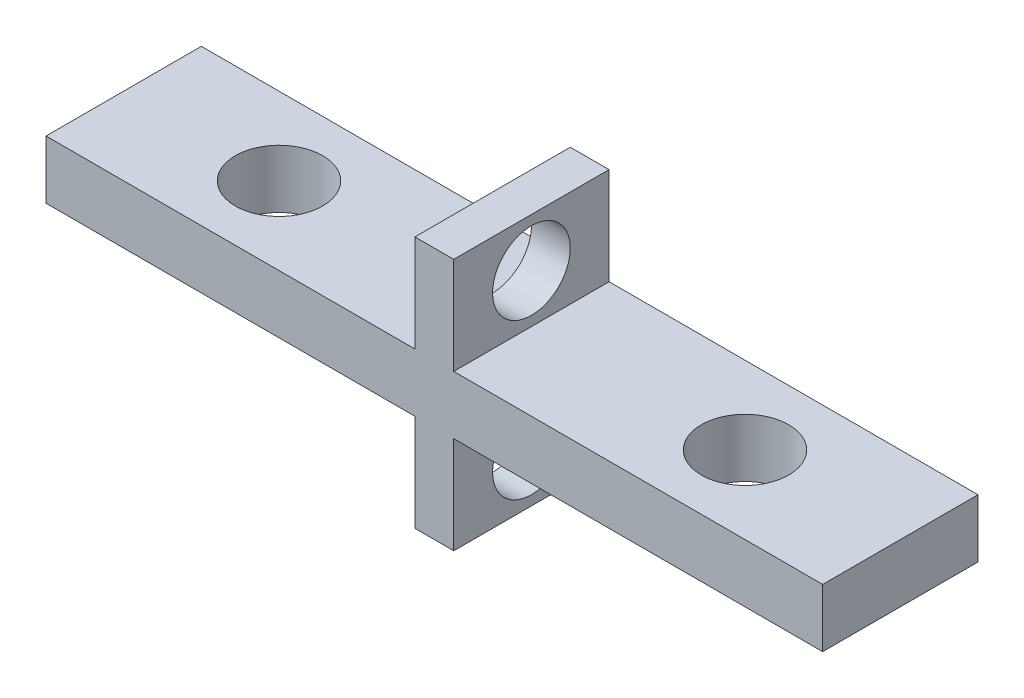
from build123d import *

# Parameters (mm, degrees)
SKETCH1_W                 = 40
SKETCH1_H                 = 8
BOSS_EXTRUDE1_DEPTH       = 3
F_8_CLEARANCE_HOLE1_D     = 4.4958
F_8_CLEARANCE_HOLE1_DEPTH = 17
F_8_CLEARANCE_HOLE1_TIP   = 1.350674586
BOSS_EXTRUDE2_DEPTH       = 5
BOSS_EXTRUDE2_DEPTH_BACK  = 8
SKETCH5_W                 = 2
SKETCH5_H                 = 8
SKETCH6_R                 = 2
CUT_EXTRUDE1_DEPTH        = 2


with BuildPart() as part:
    # Sketch1 → Boss-Extrude1 (new body)
    with BuildSketch(Plane(origin=(0, 0, 0), x_dir=(1, 0, 0), z_dir=(0, 1, 0))):
        with Locations((12.773632998, 0.313559322)):
            Rectangle(SKETCH1_W, SKETCH1_H)
    extrude(amount=BOSS_EXTRUDE1_DEPTH)

    # #8 Clearance Hole1
    with Locations(Plane(origin=(0.773632998, 3, -0.313559322), x_dir=(0, 0, 1), z_dir=(0, 1, 0))):
        with Locations((0, 0), (0, 24)):
            Hole(F_8_CLEARANCE_HOLE1_D / 2, depth=F_8_CLEARANCE_HOLE1_DEPTH)
            with Locations((0, 0, -(F_8_CLEARANCE_HOLE1_DEPTH + F_8_CLEARANCE_HOLE1_TIP / 2))):  # 118° drill point
                Cone(0, F_8_CLEARANCE_HOLE1_D / 2, F_8_CLEARANCE_HOLE1_TIP, mode=Mode.SUBTRACT)

    # Sketch5 → Boss-Extrude2 (add, two sides: drawn at the far end of the back side and taken through both)
    with BuildSketch(Plane(origin=(0, 3, 0), x_dir=(1, 0, 0), z_dir=(0, 1, 0)).offset(-BOSS_EXTRUDE2_DEPTH_BACK)):
        with Locations((12.773632998, 0.313559322)):
            Rectangle(SKETCH5_W, SKETCH5_H)
    extrude(amount=BOSS_EXTRUDE2_DEPTH + BOSS_EXTRUDE2_DEPTH_BACK)

    # Sketch6 → Cut-Extrude1 (cut)
    with BuildSketch(Plane.ZY.offset(-11.773632998)):
        with Locations((-0.313559322, 5.5)):
            Circle(SKETCH6_R)
        with Locations((-0.313559322, -2.5)):
            Circle(SKETCH6_R)
    extrude(amount=-CUT_EXTRUDE1_DEPTH, mode=Mode.SUBTRACT)


solid = part.part
